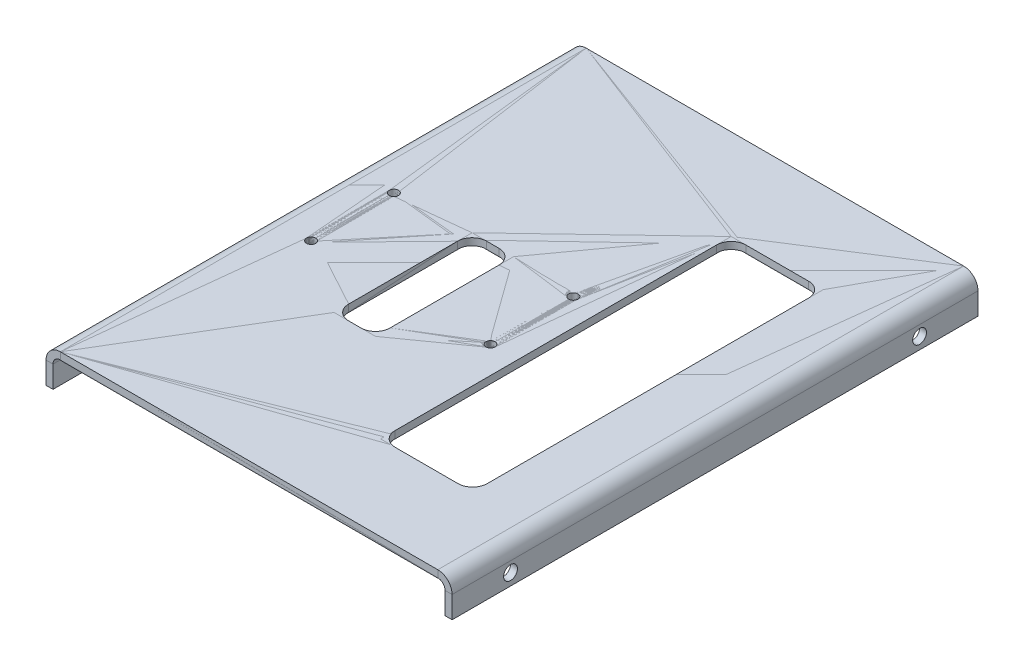
from build123d import *

# Parameters (mm, degrees)
ESQUISSE1_W                      = 82.039
ESQUISSE1_H                      = 114.3
ESQUISSE1_R                      = 1
ESQUISSE1_W_2                    = 20
ESQUISSE1_H_2                    = 76.2
ESQUISSE1_W_3                    = 9
ESQUISSE1_H_3                    = 30
BOSS_EXTRU_1_DEPTH               = 1.5875
CONVERTIR_VOLUME1_START          = 0.0635
CONVERTIR_VOLUME1_OUTLINE_W      = 82.039
CONVERTIR_VOLUME1_OUTLINE_H      = 114.3
CONVERTIR_VOLUME1_OUTLINE_R      = 1
CONVERTIR_VOLUME1_OUTLINE_W_2    = 9
CONVERTIR_VOLUME1_OUTLINE_H_2    = 30
CONVERTIR_VOLUME1_OUTLINE_W_3    = 20
CONVERTIR_VOLUME1_OUTLINE_H_3    = 76.2
CONVERTIR_VOLUME1_DEPTH          = 1.524
T_LE_PLI_E_SUR_AR_TE1_DEPTH      = 114.3
T_LE_START                       = -1.524
T_LE_PLI_E_SUR_AR_TE1_PROFILE_W  = 114.3
T_LE_PLI_E_SUR_AR_TE1_PROFILE_H  = 4.7625
T_LE_PLI_E_SUR_AR_TE1_PROFILE_R  = 1.5
T_LE_PLI_E_SUR_AR_TE1_FLAT_DEPTH = 1.524
T_LE_PLI_E_SUR_AR_TE4_DEPTH      = 114.3
T_LE_PLI_E_SUR_AR_TE4_PROFILE_W  = 114.3
T_LE_PLI_E_SUR_AR_TE4_PROFILE_H  = 4.7625
T_LE_PLI_E_SUR_AR_TE4_PROFILE_R  = 1.5
T_LE_PLI_E_SUR_AR_TE4_FLAT_DEPTH = 1.524
CONG_1_R                         = 3.175


with BuildPart() as part:
    # Esquisse1 → Boss.-Extru.1 (new body)
    with BuildSketch(Plane(origin=(0, 0, 0), x_dir=(1, 0, 0), z_dir=(0, 1, 0))):
        with Locations((41.0195, 57.15)):
            Rectangle(ESQUISSE1_W, ESQUISSE1_H)
        with Locations(Location((6.35, 66.15, 0), (0, 0, 270))):
            Circle(ESQUISSE1_R, mode=Mode.SUBTRACT)
        with Locations(Location((45.35, 66.15, 0), (0, 0, 270))):
            Circle(ESQUISSE1_R, mode=Mode.SUBTRACT)
        with Locations(Location((45.35, 48.15, 0), (0, 0, 90))):
            Circle(ESQUISSE1_R, mode=Mode.SUBTRACT)
        with Locations(Location((6.35, 48.15, 0), (0, 0, 90))):
            Circle(ESQUISSE1_R, mode=Mode.SUBTRACT)
        with Locations((61.205916091, 56.504752132)):
            Rectangle(ESQUISSE1_W_2, ESQUISSE1_H_2, mode=Mode.SUBTRACT)
        with Locations((26.85, 52.15)):
            Rectangle(ESQUISSE1_W_3, ESQUISSE1_H_3, mode=Mode.SUBTRACT)
    extrude(amount=BOSS_EXTRU_1_DEPTH)


with BuildPart() as body_2:
    # Convertir-Volume1: read off the stored shape, not the designer's step
    # Convertir-Volume1 outline → Convertir-Volume1 (new body)
    with BuildSketch(Plane(origin=(0, 0, 0), x_dir=(1, 0, 0), z_dir=(0, 1, 0)).offset(CONVERTIR_VOLUME1_START)):
        with Locations((41.0195, 57.15)):
            Rectangle(CONVERTIR_VOLUME1_OUTLINE_W, CONVERTIR_VOLUME1_OUTLINE_H)
        with Locations((6.35, 48.15)):
            Circle(CONVERTIR_VOLUME1_OUTLINE_R, mode=Mode.SUBTRACT)
        with Locations((26.85, 52.15)):
            Rectangle(CONVERTIR_VOLUME1_OUTLINE_W_2, CONVERTIR_VOLUME1_OUTLINE_H_2, mode=Mode.SUBTRACT)
        with Locations((45.35, 48.15)):
            Circle(CONVERTIR_VOLUME1_OUTLINE_R, mode=Mode.SUBTRACT)
        with Locations((61.205916091, 56.504752132)):
            Rectangle(CONVERTIR_VOLUME1_OUTLINE_W_3, CONVERTIR_VOLUME1_OUTLINE_H_3, mode=Mode.SUBTRACT)
        with Locations((6.35, 66.15)):
            Circle(CONVERTIR_VOLUME1_OUTLINE_R, mode=Mode.SUBTRACT)
        with Locations((45.35, 66.15)):
            Circle(CONVERTIR_VOLUME1_OUTLINE_R, mode=Mode.SUBTRACT)
    extrude(amount=CONVERTIR_VOLUME1_DEPTH)

    # Tôle pliée sur arête1: sheet metal written as solids
    # Tôle pliée sur arête1 bend section (on a plane across the edge) → Tôle pliée sur arête1 (add)
    with BuildSketch(Plane(origin=(-1.5875, 0.0635, 0), x_dir=(1, 0, 0), z_dir=(0, 0, -1))):
        with BuildLine():
            Line((-1.524, 1.5875), (0, 1.5875))
            ThreePointArc((0, 1.5875), (0.464967985, 0.464967985), (1.5875, 0))
            Line((1.5875, 0), (1.5875, -1.524))
            ThreePointArc((1.5875, -1.524), (-0.61266275, -0.61266275), (-1.524, 1.5875))
        make_face()
    extrude(amount=T_LE_PLI_E_SUR_AR_TE1_DEPTH)

    # Tôle pliée sur arête1 profile (on flange) → Tôle pliée sur arête1 flat (add)
    with BuildSketch(Plane(origin=(-1.5875, 0.0635, 0), x_dir=(0, 0, 1), z_dir=(1, 0, 0)).offset(T_LE_START)):
        with Locations((-57.15, 3.96875)):
            Rectangle(T_LE_PLI_E_SUR_AR_TE1_PROFILE_W, T_LE_PLI_E_SUR_AR_TE1_PROFILE_H)
        with Locations((-12.7, 3.81)):
            Circle(T_LE_PLI_E_SUR_AR_TE1_PROFILE_R, mode=Mode.SUBTRACT)
        with Locations((-101.6, 3.81)):
            Circle(T_LE_PLI_E_SUR_AR_TE1_PROFILE_R, mode=Mode.SUBTRACT)
    extrude(amount=T_LE_PLI_E_SUR_AR_TE1_FLAT_DEPTH)

    # Tôle pliée sur arête4: sheet metal written as solids
    # Tôle pliée sur arête4 bend section (on a plane across the edge) → Tôle pliée sur arête4 (add)
    with BuildSketch(Plane(origin=(83.6265, 0.0635, -114.3), x_dir=(-1, 0, 0), z_dir=(0, 0, 1))):
        with BuildLine():
            Line((-1.524, 1.5875), (0, 1.5875))
            ThreePointArc((0, 1.5875), (0.464967985, 0.464967985), (1.5875, 0))
            Line((1.5875, 0), (1.5875, -1.524))
            ThreePointArc((1.5875, -1.524), (-0.61266275, -0.61266275), (-1.524, 1.5875))
        make_face()
    extrude(amount=T_LE_PLI_E_SUR_AR_TE4_DEPTH)

    # Tôle pliée sur arête4 profile (on flange) → Tôle pliée sur arête4 flat (add)
    with BuildSketch(Plane(origin=(83.6265, 0.0635, 0), x_dir=(0, 0, -1), z_dir=(-1, 0, 0)).offset(T_LE_START)):
        with Locations((57.15, 3.96875)):
            Rectangle(T_LE_PLI_E_SUR_AR_TE4_PROFILE_W, T_LE_PLI_E_SUR_AR_TE4_PROFILE_H)
        with Locations((12.7, 3.81)):
            Circle(T_LE_PLI_E_SUR_AR_TE4_PROFILE_R, mode=Mode.SUBTRACT)
        with Locations((101.6, 3.81)):
            Circle(T_LE_PLI_E_SUR_AR_TE4_PROFILE_R, mode=Mode.SUBTRACT)
    extrude(amount=T_LE_PLI_E_SUR_AR_TE4_FLAT_DEPTH)

    # Congé1
    cong_1_edges = [body_2.edges().sort_by_distance(p)[0] for p in [
        (51.205916091, 0.8255, -94.604752132),
        (51.205916091, 0.8255, -18.404752132),
        (71.205916091, 0.8255, -18.404752132),
        (71.205916091, 0.8255, -94.604752132),
        (22.35, 0.8255, -67.15),
        (22.35, 0.8255, -37.15),
        (31.35, 0.8255, -37.15),
        (31.35, 0.8255, -67.15),
    ]]
    fillet(cong_1_edges, radius=CONG_1_R)


solid = Compound([part.part, body_2.part])
